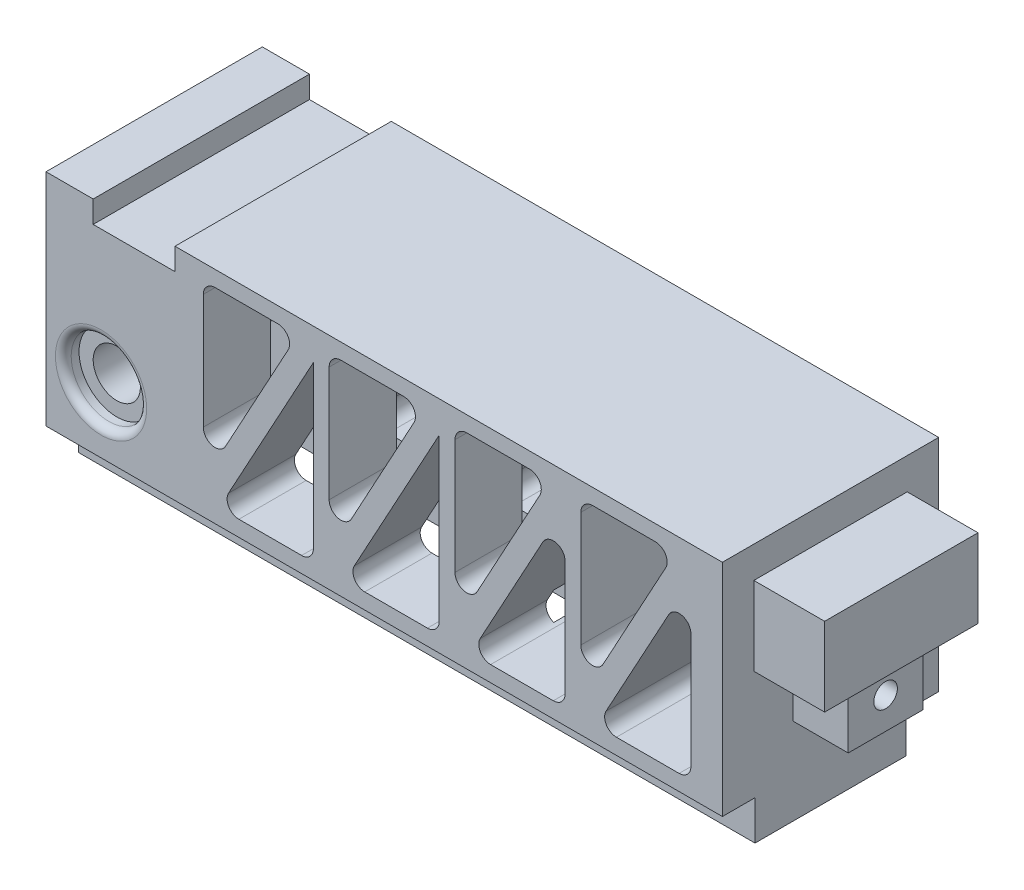
from build123d import *

# Parameters (mm, degrees)
BOSS_EXTRUDE2_DEPTH     = 5
SKETCH3_W               = 56
SKETCH3_H               = 8.55
BOSS_EXTRUDE3_DEPTH     = 28
CUT_EXTRUDE1_DEPTH      = 95.531740701
CUT_EXTRUDE1_DEPTH_BACK = 95.531740701
SKETCH4_R               = 3
CUT_EXTRUDE2_DEPTH      = 95.531740701
CUT_EXTRUDE2_DEPTH_BACK = 2
SKETCH5_R               = 4.8
CUT_EXTRUDE3_START      = -3.2
SKETCH6_R               = 4.8
CUT_EXTRUDE3_DEPTH      = 3.2
SKETCH7_W               = 56
SKETCH7_H               = 10.4
BOSS_EXTRUDE4_DEPTH     = 5
SKETCH8_W               = 30
SKETCH8_H               = 27.5
BOSS_EXTRUDE5_DEPTH     = 28
CUT_EXTRUDE4_DEPTH      = 95.531740701
LPATTERN1_COUNT         = 4
LPATTERN1_PITCH         = 16
SKETCH11_R              = 1.5
BOSS_EXTRUDE6_DEPTH     = 7
FILLET1_R               = 1.5
SKETCH13_W              = 19.5
SKETCH13_H              = 10
BOSS_EXTRUDE7_DEPTH     = 9
SKETCH14_W              = 9.5
SKETCH14_H              = 8
BOSS_EXTRUDE8_DEPTH     = 7
SKETCH15_R              = 1.5
CUT_EXTRUDE5_DEPTH      = 5
SKETCH16_W              = 10.4
SKETCH16_H              = 27.5
CUT_EXTRUDE6_DEPTH      = 2.8
FILLET2_R               = 1


with BuildPart() as part:
    # Sketch2 → Boss-Extrude2 (new body)
    with BuildSketch(Plane(origin=(0, 0, 0), x_dir=(1, 0, 0), z_dir=(0, 1, 0))):
        Polygon((0, 0), (86, 0), (86, 4.15), (86, 14.25), (86, 19.2), (0, 19.2), (0, 14.8), (56, 14.8), (56, 4.4), (0, 4.4), align=None)
    extrude(amount=-BOSS_EXTRUDE2_DEPTH)

    # Sketch3 → Boss-Extrude3 (add)
    with BuildSketch(Plane(origin=(0, 0, 0), x_dir=(1, 0, 0), z_dir=(0, 1, 0))):
        with Locations((28, 19.075)):
            Rectangle(SKETCH3_W, SKETCH3_H)
        with Locations((28, 0.125)):
            Rectangle(SKETCH3_W, SKETCH3_H)
    extrude(amount=BOSS_EXTRUDE3_DEPTH)

    # Sketch4 → Cut-Extrude1 (cut, two sides: drawn at the far end of the back side and taken through both)
    with BuildSketch(Plane.XY.offset(4.15).offset(-CUT_EXTRUDE1_DEPTH_BACK)):
        with Locations(Location((7, 8.3, 0), (0, 0, 180))):
            Circle(SKETCH4_R)
    extrude(amount=CUT_EXTRUDE1_DEPTH + CUT_EXTRUDE1_DEPTH_BACK, mode=Mode.SUBTRACT)

    # Sketch5 → Cut-Extrude2 (cut, two sides: drawn at the far end of the back side and taken through both)
    with BuildSketch(Plane.XY.offset(4.15).offset(-CUT_EXTRUDE2_DEPTH_BACK)):
        with Locations(Location((7, 8.3, 0), (0, 0, 180))):
            Circle(SKETCH5_R)
    extrude(amount=CUT_EXTRUDE2_DEPTH + CUT_EXTRUDE2_DEPTH_BACK, mode=Mode.SUBTRACT)

    # Sketch6 → Cut-Extrude3 (cut)
    with BuildSketch(Plane(origin=(0, 0, -23.35), x_dir=(-1, 0, 0), z_dir=(0, 0, -1)).offset(CUT_EXTRUDE3_START)):
        with Locations((-7, 8.3)):
            Circle(SKETCH6_R)
    extrude(amount=CUT_EXTRUDE3_DEPTH, mode=Mode.SUBTRACT)

    # Sketch7 → Boss-Extrude4 (add)
    with BuildSketch(Plane(origin=(0, 28, 0), x_dir=(1, 0, 0), z_dir=(0, 1, 0))):
        with Locations((28, 9.6)):
            Rectangle(SKETCH7_W, SKETCH7_H)
    extrude(amount=-BOSS_EXTRUDE4_DEPTH)

    # Sketch8 → Boss-Extrude5 (add)
    with BuildSketch(Plane(origin=(0, 0, 0), x_dir=(1, 0, 0), z_dir=(0, 1, 0))):
        with Locations((71, 9.6)):
            Rectangle(SKETCH8_W, SKETCH8_H)
    extrude(amount=BOSS_EXTRUDE5_DEPTH)

    # Sketch12 → Cut-Extrude4 (cut, symmetric)
    with BuildSketch(Plane.XY.offset(4.15)):
        Polygon((82, 24), (82, 2), (70, 2), align=None)
        Polygon((80, 26), (68, 26), (68, 4), align=None)
    cut_extrude4 = extrude(amount=CUT_EXTRUDE4_DEPTH, both=True, mode=Mode.SUBTRACT)

    # LPattern1: Cut-Extrude4 ×4
    with Locations(*[(-i * LPATTERN1_PITCH, 0, 0) for i in range(1, LPATTERN1_COUNT)]):
        add(cut_extrude4, mode=Mode.SUBTRACT)

    # Sketch11 → Boss-Extrude6 (add)
    with BuildSketch(Plane.XZ.offset(-26)):
        with Locations(Location((29.4, -9.55, 0), (0, 0, 180))):
            Circle(SKETCH11_R)
    extrude(amount=BOSS_EXTRUDE6_DEPTH)

    # Fillet1
    # the kernel refuses this fillet: 1.5 mm, written as the material it adds along each edge
    with BuildSketch(Plane(origin=(80, 26, 4.15), x_dir=(-1, 0, 0), z_dir=(0, 0, -1)), Plane(origin=(70, 2, -23.35), x_dir=(0.4788521306805733, 0.8778955729143845, 0), z_dir=(0, 0, 1)), Plane(origin=(48, 26, 4.15), x_dir=(-1, 0, 0), z_dir=(0, 0, -1)), Plane(origin=(64, 26, 4.15), x_dir=(-1, 0, 0), z_dir=(0, 0, -1)), Plane(origin=(32, 26, 4.15), x_dir=(-1, 0, 0), z_dir=(0, 0, -1))) as fillet1_piece_1:
        with BuildLine():
            CenterArc((FILLET1_R * 1.68454218965, -FILLET1_R), FILLET1_R, 90, 118.610459666)
            Line((FILLET1_R * 0.806646616735, -FILLET1_R * 1.47885213068), (0, 0))
            Line((0, 0), (FILLET1_R * 1.68454218965, 0))
        make_face()
    extrude(amount=27.5)
    with BuildSketch(Plane(origin=(68, 4, 4.15), x_dir=(0.4788521306805736, 0.8778955729143842, 0), z_dir=(0, 0, -1))) as fillet1_piece_2:
        with BuildLine():
            CenterArc((FILLET1_R * 3.92166068102, -FILLET1_R), FILLET1_R, 90, 151.389540334)
            Line((FILLET1_R * 3.44280855034, -FILLET1_R * 1.87789557291), (0, 0))
            Line((0, 0), (FILLET1_R * 3.92166068102, 0))
        make_face()
    extrude(amount=27.5)
    with BuildSketch(Plane(origin=(68, 26, -23.35), x_dir=(1, 0, 0), z_dir=(0, 0, 1)), Plane(origin=(36, 26, -23.35), x_dir=(1, 0, 0), z_dir=(0, 0, 1)), Plane(origin=(52, 26, -23.35), x_dir=(1, 0, 0), z_dir=(0, 0, 1)), Plane(origin=(20, 26, -23.35), x_dir=(1, 0, 0), z_dir=(0, 0, 1))) as fillet1_piece_3:
        with BuildLine():
            CenterArc((FILLET1_R, -FILLET1_R), FILLET1_R, 90, 90)
            Line((0, -FILLET1_R), (0, 0))
            Line((0, 0), (FILLET1_R, 0))
        make_face()
    extrude(amount=27.5)
    with BuildSketch(Plane(origin=(82, 24, -23.35), x_dir=(-0.47885213068057286, -0.8778955729143847, 0), z_dir=(0, 0, 1)), Plane(origin=(66, 24, -23.35), x_dir=(-0.47885213068057303, -0.8778955729143846, 0), z_dir=(0, 0, 1))) as fillet1_piece_4:
        with BuildLine():
            CenterArc((FILLET1_R * 3.92166068102, FILLET1_R), FILLET1_R, 118.610459666, 151.389540334)
            Line((FILLET1_R * 3.44280855034, FILLET1_R * 1.87789557291), (0, 0))
            Line((0, 0), (FILLET1_R * 3.92166068102, 0))
        make_face()
    extrude(amount=27.5)
    with BuildSketch(Plane(origin=(82, 2, 4.15), x_dir=(-1, 0, 0), z_dir=(0, 0, -1)), Plane(origin=(66, 2, 4.15), x_dir=(-1, 0, 0), z_dir=(0, 0, -1))) as fillet1_piece_5:
        with BuildLine():
            CenterArc((FILLET1_R, FILLET1_R), FILLET1_R, 180, 90)
            Line((0, FILLET1_R), (0, 0))
            Line((0, 0), (FILLET1_R, 0))
        make_face()
    extrude(amount=27.5)
    with BuildSketch(Plane(origin=(34, 2, 4.15), x_dir=(-1, 0, 0), z_dir=(0, 0, -1)), Plane(origin=(50, 2, 4.15), x_dir=(-1, 0, 0), z_dir=(0, 0, -1))) as fillet1_piece_6:
        with BuildLine():
            CenterArc((FILLET1_R, FILLET1_R), FILLET1_R, 180, 90)
            Line((0, FILLET1_R), (0, 0))
            Line((0, 0), (FILLET1_R, 0))
        make_face()
    extrude(amount=8.55)
    with BuildSketch(Plane(origin=(34, 2, -14.8), x_dir=(0, 1, 0), z_dir=(0, 0, -1))) as fillet1_piece_7:
        with BuildLine():
            CenterArc((FILLET1_R, -FILLET1_R), FILLET1_R, 90, 90)
            Line((0, -FILLET1_R), (0, 0))
            Line((0, 0), (FILLET1_R, 0))
        make_face()
    extrude(amount=8.55)
    with BuildSketch(Plane(origin=(22, 2, -4.4), x_dir=(0.4788521306805726, 0.8778955729143848, 0), z_dir=(0, 0, 1)), Plane(origin=(22, 2, -23.35), x_dir=(0.4788521306805726, 0.8778955729143848, 0), z_dir=(0, 0, 1)), Plane(origin=(38, 2, -4.4), x_dir=(0.4788521306805726, 0.8778955729143847, 0), z_dir=(0, 0, 1)), Plane(origin=(38, 2, -23.35), x_dir=(0.4788521306805726, 0.8778955729143847, 0), z_dir=(0, 0, 1))) as fillet1_piece_8:
        with BuildLine():
            CenterArc((FILLET1_R * 1.68454218965, -FILLET1_R), FILLET1_R, 90, 118.610459666)
            Line((FILLET1_R * 0.806646616735, -FILLET1_R * 1.47885213068), (0, 0))
            Line((0, 0), (FILLET1_R * 1.68454218965, 0))
        make_face()
    extrude(amount=8.55)
    with BuildSketch(Plane(origin=(36, 4, 4.15), x_dir=(0.47885213068057314, 0.8778955729143845, 0), z_dir=(0, 0, -1)), Plane(origin=(36, 4, -14.8), x_dir=(0.47885213068057314, 0.8778955729143845, 0), z_dir=(0, 0, -1)), Plane(origin=(52, 4, 4.15), x_dir=(0.47885213068057303, 0.8778955729143846, 0), z_dir=(0, 0, -1)), Plane(origin=(52, 4, -14.8), x_dir=(0.47885213068057303, 0.8778955729143846, 0), z_dir=(0, 0, -1))) as fillet1_piece_9:
        with BuildLine():
            CenterArc((FILLET1_R * 3.92166068102, -FILLET1_R), FILLET1_R, 90, 151.389540334)
            Line((FILLET1_R * 3.44280855034, -FILLET1_R * 1.87789557291), (0, 0))
            Line((0, 0), (FILLET1_R * 3.92166068102, 0))
        make_face()
    extrude(amount=8.55)
    with BuildSketch(Plane(origin=(36, 4, 4.15), x_dir=(0.47885213068057314, 0.8778955729143845, 0), z_dir=(0, 0, -1))) as fillet1_piece_10_section:
        with BuildLine():
            CenterArc((FILLET1_R * 3.92166068102, -FILLET1_R), FILLET1_R, 90, 151.389540334)
            Line((FILLET1_R * 3.44280855034, -FILLET1_R * 1.87789557291), (0, 0))
            Line((0, 0), (FILLET1_R * 3.92166068102, 0))
        make_face()
    fillet1_piece_10 = extrude(amount=23.256227554, mode=Mode.PRIVATE)
    fillet1_piece_10 = split(fillet1_piece_10, bisect_by=Plane(origin=(36.786949265, 7.086147992, -14.8), z_dir=(0, 0, -1)), keep=Keep.TOP, mode=Mode.PRIVATE)
    add(fillet1_piece_10)
    with BuildSketch(Plane(origin=(36, 4, -0.093772446), x_dir=(0.47885213068057314, 0.8778955729143845, 0), z_dir=(0, 0, -1))) as fillet1_piece_11_section:
        with BuildLine():
            CenterArc((FILLET1_R * 3.92166068102, -FILLET1_R), FILLET1_R, 90, 151.389540334)
            Line((FILLET1_R * 3.44280855034, -FILLET1_R * 1.87789557291), (0, 0))
            Line((0, 0), (FILLET1_R * 3.92166068102, 0))
        make_face()
    fillet1_piece_11 = extrude(amount=23.256227554, mode=Mode.PRIVATE)
    fillet1_piece_11 = split(fillet1_piece_11, bisect_by=Plane(origin=(36.786949265, 7.086147992, -4.4), z_dir=(0, 0, 1)), keep=Keep.TOP, mode=Mode.PRIVATE)
    add(fillet1_piece_11)
    with BuildSketch(Plane(origin=(52, 4, 4.15), x_dir=(0.47885213068057303, 0.8778955729143846, 0), z_dir=(0, 0, -1))) as fillet1_piece_12_section:
        with BuildLine():
            CenterArc((FILLET1_R * 3.92166068102, -FILLET1_R), FILLET1_R, 90, 151.389540334)
            Line((FILLET1_R * 3.44280855034, -FILLET1_R * 1.87789557291), (0, 0))
            Line((0, 0), (FILLET1_R * 3.92166068102, 0))
        make_face()
    fillet1_piece_12 = extrude(amount=23.256227554, mode=Mode.PRIVATE)
    fillet1_piece_12 = split(fillet1_piece_12, bisect_by=Plane(origin=(52.786949265, 7.086147992, -14.8), z_dir=(0, 0, -1)), keep=Keep.TOP, mode=Mode.PRIVATE)
    add(fillet1_piece_12)
    with BuildSketch(Plane(origin=(52, 4, -0.093772446), x_dir=(0.47885213068057303, 0.8778955729143846, 0), z_dir=(0, 0, -1))) as fillet1_piece_13_section:
        with BuildLine():
            CenterArc((FILLET1_R * 3.92166068102, -FILLET1_R), FILLET1_R, 90, 151.389540334)
            Line((FILLET1_R * 3.44280855034, -FILLET1_R * 1.87789557291), (0, 0))
            Line((0, 0), (FILLET1_R * 3.92166068102, 0))
        make_face()
    fillet1_piece_13 = extrude(amount=23.256227554, mode=Mode.PRIVATE)
    fillet1_piece_13 = split(fillet1_piece_13, bisect_by=Plane(origin=(52.786949265, 7.086147992, -4.4), z_dir=(0, 0, 1)), keep=Keep.TOP, mode=Mode.PRIVATE)
    add(fillet1_piece_13)
    with BuildSketch(Plane(origin=(20, 4, 4.15), x_dir=(0, 1, 0), z_dir=(0, 0, -1)), Plane(origin=(20, 4, -14.8), x_dir=(0, 1, 0), z_dir=(0, 0, -1))) as fillet1_piece_14:
        with BuildLine():
            CenterArc((FILLET1_R * 3.92166068102, FILLET1_R), FILLET1_R, 118.610459666, 151.389540334)
            Line((FILLET1_R * 3.44280855034, FILLET1_R * 1.87789557291), (0, 0))
            Line((0, 0), (FILLET1_R * 3.92166068102, 0))
        make_face()
    extrude(amount=8.55)
    with BuildSketch(Plane(origin=(20, 4, 4.15), x_dir=(0, 1, 0), z_dir=(0, 0, -1))) as fillet1_piece_15_section:
        with BuildLine():
            CenterArc((FILLET1_R * 3.92166068102, FILLET1_R), FILLET1_R, 118.610459666, 151.389540334)
            Line((FILLET1_R * 3.44280855034, FILLET1_R * 1.87789557291), (0, 0))
            Line((0, 0), (FILLET1_R * 3.92166068102, 0))
        make_face()
    fillet1_piece_15 = extrude(amount=23.256227554, mode=Mode.PRIVATE)
    fillet1_piece_15 = split(fillet1_piece_15, bisect_by=Plane(origin=(20.786949265, 7.086147992, -14.8), z_dir=(0, 0, -1)), keep=Keep.TOP, mode=Mode.PRIVATE)
    add(fillet1_piece_15)
    with BuildSketch(Plane(origin=(20, 4, -0.093772446), x_dir=(0, 1, 0), z_dir=(0, 0, -1))) as fillet1_piece_16_section:
        with BuildLine():
            CenterArc((FILLET1_R * 3.92166068102, FILLET1_R), FILLET1_R, 118.610459666, 151.389540334)
            Line((FILLET1_R * 3.44280855034, FILLET1_R * 1.87789557291), (0, 0))
            Line((0, 0), (FILLET1_R * 3.92166068102, 0))
        make_face()
    fillet1_piece_16 = extrude(amount=23.256227554, mode=Mode.PRIVATE)
    fillet1_piece_16 = split(fillet1_piece_16, bisect_by=Plane(origin=(20.786949265, 7.086147992, -4.4), z_dir=(0, 0, 1)), keep=Keep.TOP, mode=Mode.PRIVATE)
    add(fillet1_piece_16)
    with BuildSketch(Plane(origin=(54, 2, -10.717033211), x_dir=(0.4788521306805727, 0.8778955729143846, 0), z_dir=(0, 0, 1))) as fillet1_piece_17_section:
        with BuildLine():
            CenterArc((FILLET1_R * 1.68454218965, -FILLET1_R), FILLET1_R, 90, 118.610459666)
            Line((FILLET1_R * 0.806646616735, -FILLET1_R * 1.47885213068), (0, 0))
            Line((0, 0), (FILLET1_R * 1.68454218965, 0))
        make_face()
    fillet1_piece_17 = extrude(amount=14.867033211, mode=Mode.PRIVATE)
    fillet1_piece_17 = split(fillet1_piece_17, bisect_by=Plane(origin=(56.19558087, 2.007259132, -4.4), z_dir=(0, 0, -1)), keep=Keep.TOP, mode=Mode.PRIVATE)
    fillet1_piece_17 = split(fillet1_piece_17, bisect_by=Plane(origin=(56, 2.007259132, -7.558516606), z_dir=(1, 0, 0)), keep=Keep.TOP, mode=Mode.PRIVATE)
    add(fillet1_piece_17)
    with BuildSketch(Plane(origin=(54, 2, -4.4), x_dir=(0.4788521306805727, 0.8778955729143846, 0), z_dir=(0, 0, 1))) as fillet1_piece_18_section:
        with BuildLine():
            CenterArc((FILLET1_R * 1.68454218965, -FILLET1_R), FILLET1_R, 90, 118.610459666)
            Line((FILLET1_R * 0.806646616735, -FILLET1_R * 1.47885213068), (0, 0))
            Line((0, 0), (FILLET1_R * 1.68454218965, 0))
        make_face()
    fillet1_piece_18 = extrude(amount=8.55, mode=Mode.PRIVATE)
    fillet1_piece_18 = split(fillet1_piece_18, bisect_by=Plane(origin=(56, 2.552378246, -0.125), z_dir=(-1, 0, 0)), keep=Keep.TOP, mode=Mode.PRIVATE)
    add(fillet1_piece_18)
    with BuildSketch(Plane(origin=(54, 2, -4.4), x_dir=(0.4788521306805727, 0.8778955729143846, 0), z_dir=(0, 0, 1))) as fillet1_piece_19_section:
        with BuildLine():
            CenterArc((FILLET1_R * 1.68454218965, -FILLET1_R), FILLET1_R, 90, 118.610459666)
            Line((FILLET1_R * 0.806646616735, -FILLET1_R * 1.47885213068), (0, 0))
            Line((0, 0), (FILLET1_R * 1.68454218965, 0))
        make_face()
    fillet1_piece_19 = extrude(amount=8.55, mode=Mode.PRIVATE)
    fillet1_piece_19 = split(fillet1_piece_19, bisect_by=Plane(origin=(56, 2.007259132, -0.125), z_dir=(1, 0, 0)), keep=Keep.TOP, mode=Mode.PRIVATE)
    add(fillet1_piece_19)
    with BuildSketch(Plane(origin=(54, 2, -23.35), x_dir=(0.4788521306805727, 0.8778955729143846, 0), z_dir=(0, 0, 1))) as fillet1_piece_20_section:
        with BuildLine():
            CenterArc((FILLET1_R * 1.68454218965, -FILLET1_R), FILLET1_R, 90, 118.610459666)
            Line((FILLET1_R * 0.806646616735, -FILLET1_R * 1.47885213068), (0, 0))
            Line((0, 0), (FILLET1_R * 1.68454218965, 0))
        make_face()
    fillet1_piece_20 = extrude(amount=8.55, mode=Mode.PRIVATE)
    fillet1_piece_20 = split(fillet1_piece_20, bisect_by=Plane(origin=(56, 2.552378246, -19.075), z_dir=(-1, 0, 0)), keep=Keep.TOP, mode=Mode.PRIVATE)
    add(fillet1_piece_20)
    with BuildSketch(Plane(origin=(54, 2, -23.35), x_dir=(0.4788521306805727, 0.8778955729143846, 0), z_dir=(0, 0, 1))) as fillet1_piece_21_section:
        with BuildLine():
            CenterArc((FILLET1_R * 1.68454218965, -FILLET1_R), FILLET1_R, 90, 118.610459666)
            Line((FILLET1_R * 0.806646616735, -FILLET1_R * 1.47885213068), (0, 0))
            Line((0, 0), (FILLET1_R * 1.68454218965, 0))
        make_face()
    fillet1_piece_21 = extrude(amount=8.55, mode=Mode.PRIVATE)
    fillet1_piece_21 = split(fillet1_piece_21, bisect_by=Plane(origin=(56, 2.007259132, -19.075), z_dir=(1, 0, 0)), keep=Keep.TOP, mode=Mode.PRIVATE)
    add(fillet1_piece_21)
    with BuildSketch(Plane(origin=(54, 2, -23.35), x_dir=(0.4788521306805727, 0.8778955729143846, 0), z_dir=(0, 0, 1))) as fillet1_piece_22_section:
        with BuildLine():
            CenterArc((FILLET1_R * 1.68454218965, -FILLET1_R), FILLET1_R, 90, 118.610459666)
            Line((FILLET1_R * 0.806646616735, -FILLET1_R * 1.47885213068), (0, 0))
            Line((0, 0), (FILLET1_R * 1.68454218965, 0))
        make_face()
    fillet1_piece_22 = extrude(amount=14.867033211, mode=Mode.PRIVATE)
    fillet1_piece_22 = split(fillet1_piece_22, bisect_by=Plane(origin=(56.19558087, 2.007259132, -14.8), z_dir=(0, 0, 1)), keep=Keep.TOP, mode=Mode.PRIVATE)
    fillet1_piece_22 = split(fillet1_piece_22, bisect_by=Plane(origin=(56, 2.007259132, -11.641483394), z_dir=(1, 0, 0)), keep=Keep.TOP, mode=Mode.PRIVATE)
    add(fillet1_piece_22)

    # Sketch13 → Boss-Extrude7 (add)
    with BuildSketch(Plane(origin=(86, 0, 0), x_dir=(0, 0, -1), z_dir=(1, 0, 0))):
        with Locations((9.6, 19)):
            Rectangle(SKETCH13_W, SKETCH13_H)
    extrude(amount=BOSS_EXTRUDE7_DEPTH)

    # Sketch14 → Boss-Extrude8 (add)
    with BuildSketch(Plane(origin=(86, 0, 0), x_dir=(0, 0, -1), z_dir=(1, 0, 0))):
        with Locations((9.6, 10)):
            Rectangle(SKETCH14_W, SKETCH14_H)
    extrude(amount=BOSS_EXTRUDE8_DEPTH)

    # Sketch15 → Cut-Extrude5 (cut)
    with BuildSketch(Plane(origin=(93, 0, 0), x_dir=(0, 0, -1), z_dir=(1, 0, 0))):
        with Locations((9.6, 10)):
            Circle(SKETCH15_R)
    extrude(amount=-CUT_EXTRUDE5_DEPTH, mode=Mode.SUBTRACT)

    # Sketch16 → Cut-Extrude6 (cut)
    with BuildSketch(Plane(origin=(0, 28, 0), x_dir=(1, 0, 0), z_dir=(0, 1, 0))):
        with Locations((11.2, 9.6)):
            Rectangle(SKETCH16_W, SKETCH16_H)
    extrude(amount=-CUT_EXTRUDE6_DEPTH, mode=Mode.SUBTRACT)

    # Fillet2
    fillet2_edges = [part.edges().sort_by_distance(p)[0] for p in [
        (11.8, 8.3, 4.15),
        (11.8, 8.3, -23.35),
    ]]
    fillet(fillet2_edges, radius=FILLET2_R)


solid = part.part
